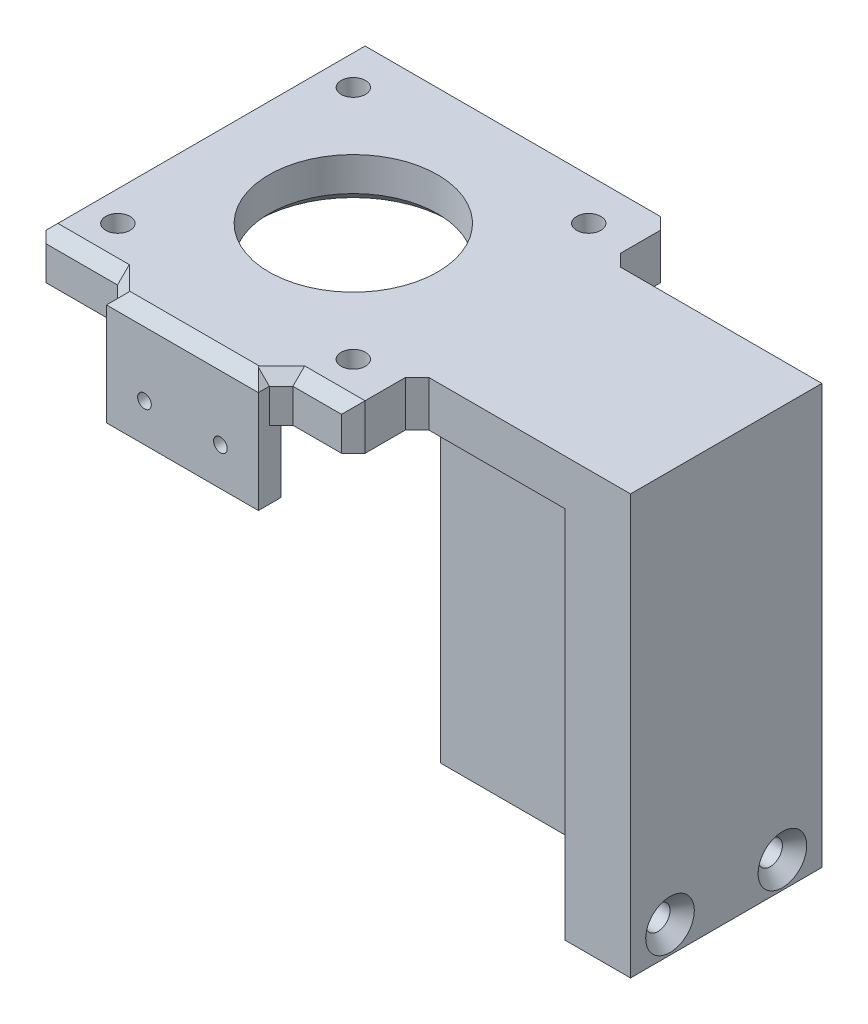
from build123d import *

# Parameters (mm, degrees)
BOSS_EXTRUDE1_DEPTH = 25.2
SKETCH2_R           = 1.6
BOSS_EXTRUDE2_DEPTH = 6
SKETCH3_W           = 19
SKETCH3_H           = 1
CUT_EXTRUDE1_DEPTH  = 38.2
CHAMFER2_SIZE       = 1.55
SKETCH4_R           = 11.1
CUT_EXTRUDE2_DEPTH  = 86.626222619
CHAMFER3_SIZE       = 1.55
CHAMFER4_SIZE       = 1
SKETCH5_R           = 1.6
CUT_EXTRUDE3_DEPTH  = 96.48869043
SKETCH6_W           = 20
SKETCH6_H           = 15
BOSS_EXTRUDE3_DEPTH = 3
SKETCH7_R           = 0.9
CUT_EXTRUDE4_DEPTH  = 95.097236941
CHAMFER7_SIZE       = 1.55
CHAMFER8_SIZE       = 1.55
SKETCH8_W           = 0.2
SKETCH8_H           = 55.2
CUT_EXTRUDE5_DEPTH  = 90.209024207
CHAMFER9_SIZE       = 1.6


with BuildPart() as part:
    # Sketch1 → Boss-Extrude1 (new body)
    with BuildSketch(Plane.XY):
        Polygon((0, 0), (0, 11), (-19, 11), (-19, 49.2), (8.8, 49.2), (8.8, 0), align=None)
    extrude(amount=BOSS_EXTRUDE1_DEPTH)

    # Sketch2 → Boss-Extrude2 (add)
    with BuildSketch(Plane(origin=(0, 49.2, 0), x_dir=(1, 0, 0), z_dir=(0, 1, 0))):
        Polygon((-61.5, 8.4), (-19.5, 8.4), (-19.5, 0), (8.8, 0), (8.8, -25.2), (-19.5, -25.2), (-19.5, -33.6), (-61.5, -33.6), align=None)
        with Locations(Location((-56, 2.9, 0), (0, 0, 180))):
            Circle(SKETCH2_R, mode=Mode.SUBTRACT)
        with Locations((-56, -28.1)):
            Circle(SKETCH2_R, mode=Mode.SUBTRACT)
        with Locations(Location((-25, -28.1, 0), (0, 0, 180))):
            Circle(SKETCH2_R, mode=Mode.SUBTRACT)
        with Locations((-25, 2.9)):
            Circle(SKETCH2_R, mode=Mode.SUBTRACT)
    extrude(amount=BOSS_EXTRUDE2_DEPTH)

    # Sketch3 → Cut-Extrude1 (cut)
    with BuildSketch(Plane.XZ.offset(-11)):
        with Locations((-9.5, 24.7)):
            Rectangle(SKETCH3_W, SKETCH3_H)
        with Locations((-9.5, 0.5)):
            Rectangle(SKETCH3_W, SKETCH3_H)
    extrude(amount=-CUT_EXTRUDE1_DEPTH, mode=Mode.SUBTRACT)

    # Chamfer2
    chamfer2_edges = [part.edges().sort_by_distance(p)[0] for p in [
        (-54.4, 49.2, -2.9),
        (-57.6, 49.2, 28.1),
        (-23.4, 49.2, 28.1),
        (-26.6, 49.2, -2.9),
    ]]
    chamfer(chamfer2_edges, length=CHAMFER2_SIZE)

    # Sketch4 → Cut-Extrude2 (cut, through all)
    with BuildSketch(Plane.XZ.offset(-49.2)):
        with Locations((-40.5, 12.6)):
            Circle(SKETCH4_R)
    extrude(amount=-CUT_EXTRUDE2_DEPTH, mode=Mode.SUBTRACT)

    # Chamfer3
    chamfer3_edges = [part.edges().sort_by_distance(p)[0] for p in [
        (-61.5, 55.2, 12.6),
        (-19.5, 52.2, 0),
        (-19.5, 52.2, -8.4),
        (-61.5, 49.2, 12.6),
        (-61.5, 52.2, -8.4),
        (-61.5, 52.2, 33.6),
        (-19.5, 52.2, 33.6),
        (-19.5, 52.2, 25.2),
        (-19, 30.1, 24.2),
        (-19, 30.1, 1),
        (-51.6, 49.2, 12.6),
    ]]
    chamfer(chamfer3_edges, length=CHAMFER3_SIZE)

    # Chamfer4
    chamfer4_edges = [part.edges().sort_by_distance(p)[0] for p in [
        (0, 30.1, 24.2),
        (0, 30.1, 1),
    ]]
    chamfer(chamfer4_edges, length=CHAMFER4_SIZE - 0.0001)  # a hair under: the kernel refuses the full size

    # Sketch5 → Cut-Extrude3 (cut, through all)
    with BuildSketch(Plane(origin=(8.8, 0, 0), x_dir=(0, 0, -1), z_dir=(1, 0, 0))):
        with Locations((-5.2, 3.5)):
            Circle(SKETCH5_R)
        with Locations(Location((-20, 3.5, 0), (0, 0, 180))):
            Circle(SKETCH5_R)
    extrude(amount=-CUT_EXTRUDE3_DEPTH, mode=Mode.SUBTRACT)

    # Sketch6 → Boss-Extrude3 (add)
    with BuildSketch(Plane.XY.offset(33.6)):
        with Locations((-39, 47.7)):
            Rectangle(SKETCH6_W, SKETCH6_H)
    extrude(amount=BOSS_EXTRUDE3_DEPTH)

    # Sketch7 → Cut-Extrude4 (cut, through all)
    with BuildSketch(Plane.XY.offset(36.6)):
        with Locations((-34, 45.2)):
            Circle(SKETCH7_R)
        with Locations((-44, 45.2)):
            Circle(SKETCH7_R)
    extrude(amount=-CUT_EXTRUDE4_DEPTH, mode=Mode.SUBTRACT)

    # Chamfer7
    chamfer7_edges = [part.edges().sort_by_distance(p)[0] for p in [
        (-29, 52.2, 33.6),
        (-25.025, 55.2, 33.6),
        (-29, 55.2, 35.1),
        (-49, 52.2, 33.6),
        (-49, 55.2, 35.1),
        (-54.475, 55.2, 33.6),
    ]]
    chamfer(chamfer7_edges, length=CHAMFER7_SIZE)

    # Chamfer8
    chamfer8_edges = [part.edges().sort_by_distance(p)[0] for p in [
        (-39, 55.2, 36.6),
    ]]
    chamfer(chamfer8_edges, length=CHAMFER8_SIZE)

    # Sketch8 → Cut-Extrude5 (cut, through all)
    with BuildSketch(Plane.XY.offset(25.2)):
        with Locations((8.7, 27.6)):
            Rectangle(SKETCH8_W, SKETCH8_H)
    extrude(amount=-CUT_EXTRUDE5_DEPTH, mode=Mode.SUBTRACT)

    # Chamfer9
    chamfer9_edges = [part.edges().sort_by_distance(p)[0] for p in [
        (8.6, 3.5, 6.8),
        (8.6, 3.5, 18.4),
    ]]
    chamfer(chamfer9_edges, length=CHAMFER9_SIZE)


solid = part.part
